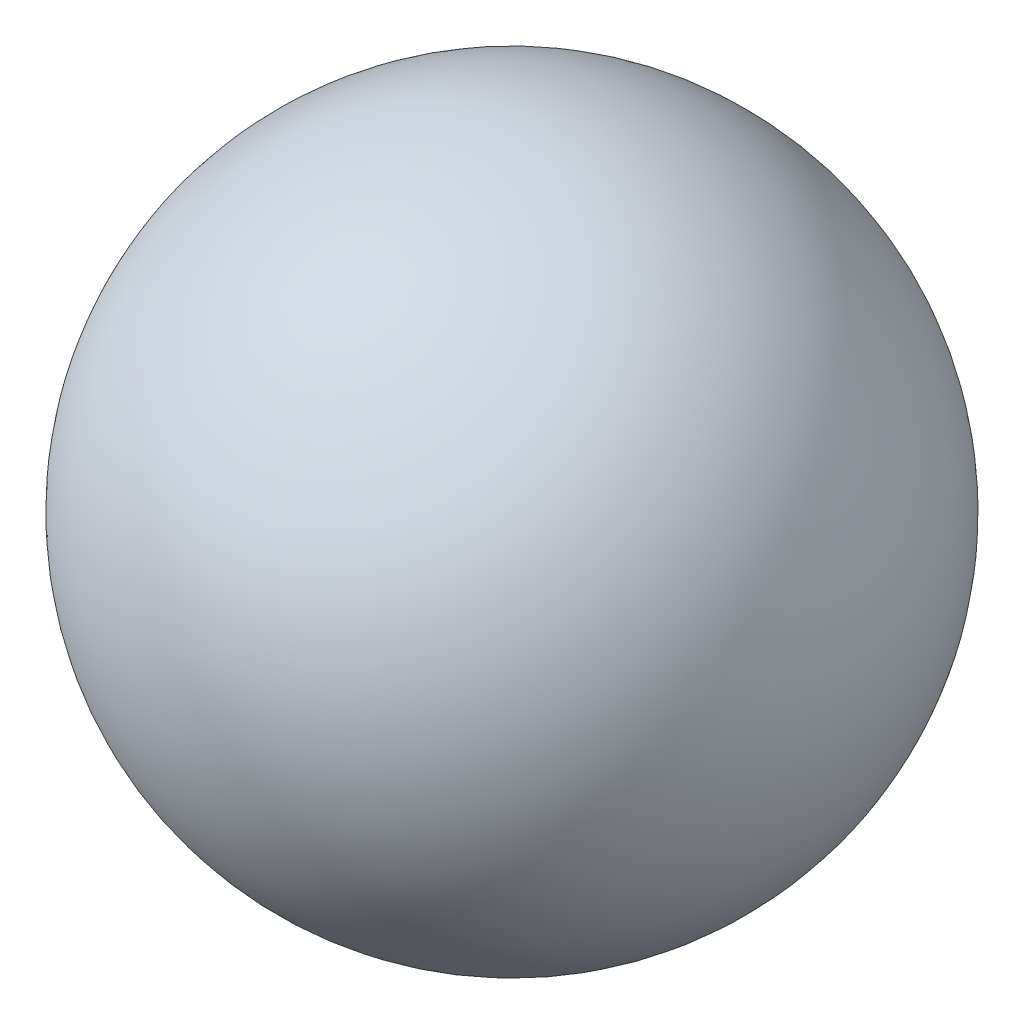
from build123d import *


with BuildPart() as part:
    # Sketch2 → Revolve3 (revolve)
    with BuildSketch(Plane.XY):
        with BuildLine():
            ThreePointArc((206.375, 0), (0, 206.375), (-206.375, 0))
            Line((-206.375, 0), (206.375, 0))
        make_face()
    revolve(axis=Axis((-206.375, 0, 0), (1, 0, 0)))


solid = part.part
